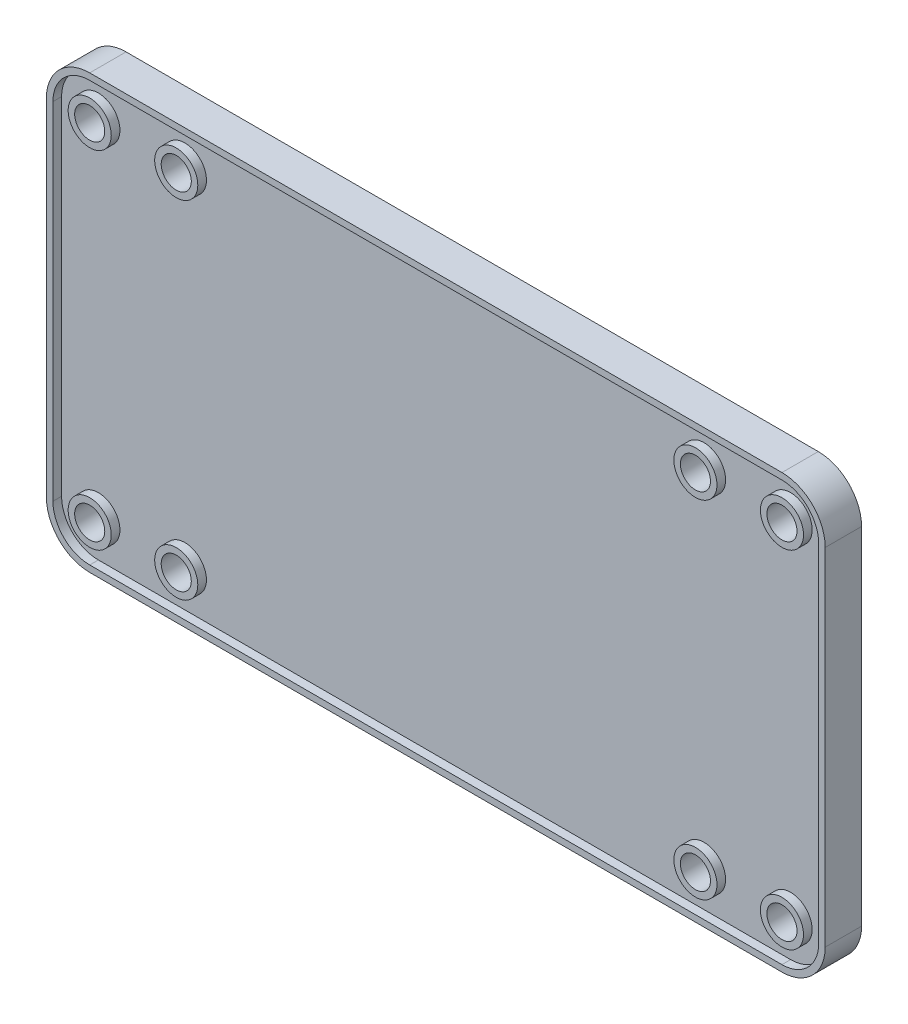
from build123d import *
from build123d.topology import SkipClean

# Parameters (mm, degrees)
SKETCH1_R           = 2.2098
BOSS_EXTRUDE1_DEPTH = 3.175
SKETCH2_R           = 3.1623
CUT_EXTRUDE3_DEPTH  = 1.27
SKETCH3_R           = 2.2098
SKETCH3_R_2         = 5.08
BOSS_EXTRUDE2_DEPTH = 2.159


with BuildPart() as part:
    # Sketch1 → Boss-Extrude1 (new body)
    with BuildSketch(Plane.XY):
        with BuildLine():
            Line((-50.8, -31.75), (50.8, -31.75))
            ThreePointArc((50.8, -31.75), (55.290128061, -29.890128061), (57.15, -25.4))
            Line((57.15, -25.4), (57.15, 25.4))
            ThreePointArc((57.15, 25.4), (55.290128061, 29.890128061), (50.8, 31.75))
            Line((50.8, 31.75), (-50.8, 31.75))
            ThreePointArc((-50.8, 31.75), (-55.290128061, 29.890128061), (-57.15, 25.4))
            Line((-57.15, 25.4), (-57.15, -25.4))
            ThreePointArc((-57.15, -25.4), (-55.290128061, -29.890128061), (-50.8, -31.75))
        make_face()
        with Locations((-50.8, -25.4)):
            Circle(SKETCH1_R, mode=Mode.SUBTRACT)
        with Locations((-38.1, -25.4)):
            Circle(SKETCH1_R, mode=Mode.SUBTRACT)
        with Locations((-50.8, 25.4)):
            Circle(SKETCH1_R, mode=Mode.SUBTRACT)
        with Locations((-38.1, 25.4)):
            Circle(SKETCH1_R, mode=Mode.SUBTRACT)
        with Locations((50.8, 25.4)):
            Circle(SKETCH1_R, mode=Mode.SUBTRACT)
        with Locations((38.1, 25.4)):
            Circle(SKETCH1_R, mode=Mode.SUBTRACT)
        with Locations((50.8, -25.4)):
            Circle(SKETCH1_R, mode=Mode.SUBTRACT)
        with Locations((38.1, -25.4)):
            Circle(SKETCH1_R, mode=Mode.SUBTRACT)
    extrude(amount=-BOSS_EXTRUDE1_DEPTH)

    # Sketch2 → Cut-Extrude3 (cut)
    with BuildSketch(Plane.XY):
        with BuildLine():
            Line((50.8, 30.7975), (-50.8, 30.7975))
            ThreePointArc((-50.8, 30.7975), (-54.616608851, 29.216608851), (-56.1975, 25.4))
            Line((-56.1975, 25.4), (-56.1975, -25.4))
            ThreePointArc((-56.1975, -25.4), (-54.616608851, -29.216608851), (-50.8, -30.7975))
            Line((-50.8, -30.7975), (50.8, -30.7975))
            ThreePointArc((50.8, -30.7975), (54.616608851, -29.216608851), (56.1975, -25.4))
            Line((56.1975, -25.4), (56.1975, 25.4))
            ThreePointArc((56.1975, 25.4), (54.616608851, 29.216608851), (50.8, 30.7975))
        make_face()
        with Locations((38.1, 25.4)):
            Circle(SKETCH2_R, mode=Mode.SUBTRACT)
        with Locations((50.8, 25.4)):
            Circle(SKETCH2_R, mode=Mode.SUBTRACT)
        with Locations((50.8, -25.4)):
            Circle(SKETCH2_R, mode=Mode.SUBTRACT)
        with Locations((38.1, -25.4)):
            Circle(SKETCH2_R, mode=Mode.SUBTRACT)
        with Locations((-38.1, -25.4)):
            Circle(SKETCH2_R, mode=Mode.SUBTRACT)
        with Locations((-50.8, -25.4)):
            Circle(SKETCH2_R, mode=Mode.SUBTRACT)
        with Locations((-38.1, 25.4)):
            Circle(SKETCH2_R, mode=Mode.SUBTRACT)
        with Locations((-50.8, 25.4)):
            Circle(SKETCH2_R, mode=Mode.SUBTRACT)
    extrude(amount=-CUT_EXTRUDE3_DEPTH, mode=Mode.SUBTRACT)

    # Sketch3 → Boss-Extrude2 (add)
    with SkipClean():  # the faces are left unmerged after this step: merging them gives an invalid solid
        with BuildSketch(Plane(origin=(0, 0, -3.175), x_dir=(-1, 0, 0), z_dir=(0, 0, -1))):
            with BuildLine():
                Line((-57.15, 25.4), (-57.15, -25.4))
                ThreePointArc((-57.15, -25.4), (-55.290128061, -29.890128061), (-50.8, -31.75))
                Line((-50.8, -31.75), (50.8, -31.75))
                ThreePointArc((50.8, -31.75), (55.290128061, -29.890128061), (57.15, -25.4))
                Line((57.15, -25.4), (57.15, 25.4))
                ThreePointArc((57.15, 25.4), (55.290128061, 29.890128061), (50.8, 31.75))
                Line((50.8, 31.75), (-50.8, 31.75))
                ThreePointArc((-50.8, 31.75), (-55.290128061, 29.890128061), (-57.15, 25.4))
            make_face()
            with Locations((-50.8, -25.4)):
                Circle(SKETCH3_R, mode=Mode.SUBTRACT)
            with Locations((-38.1, -25.4)):
                Circle(SKETCH3_R, mode=Mode.SUBTRACT)
            with Locations((38.1, -25.4)):
                Circle(SKETCH3_R, mode=Mode.SUBTRACT)
            with Locations((50.8, -25.4)):
                Circle(SKETCH3_R, mode=Mode.SUBTRACT)
            with Locations((50.8, 25.4)):
                Circle(SKETCH3_R, mode=Mode.SUBTRACT)
            with Locations((38.1, 25.4)):
                Circle(SKETCH3_R, mode=Mode.SUBTRACT)
            with Locations((-38.1, 25.4)):
                Circle(SKETCH3_R, mode=Mode.SUBTRACT)
            with Locations((-50.8, 25.4)):
                Circle(SKETCH3_R, mode=Mode.SUBTRACT)
            Circle(SKETCH3_R_2, mode=Mode.SUBTRACT)
            with Locations((38.1, 0)):
                Circle(SKETCH3_R_2, mode=Mode.SUBTRACT)
            with Locations((-38.1, 0)):
                Circle(SKETCH3_R_2, mode=Mode.SUBTRACT)
        extrude(amount=BOSS_EXTRUDE2_DEPTH)


solid = part.part
